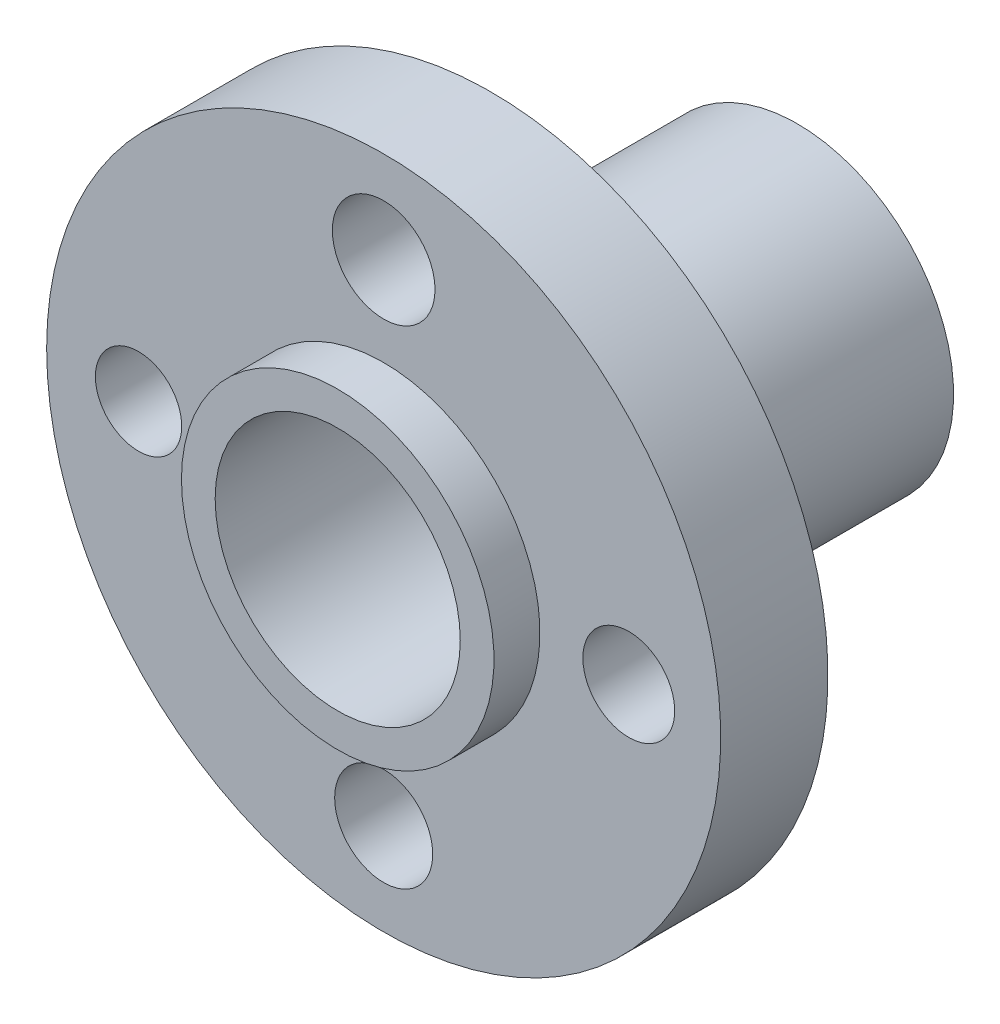
from build123d import *

# Parameters (mm, degrees)
SKETCH2_R          = 4
CUT_EXTRUDE1_DEPTH = 22.610182785
SKETCH3_R          = 1.409137036
SKETCH3_R_2        = 1.6
SKETCH3_R_3        = 1.49849824
SKETCH3_R_4        = 1.674312885
CUT_EXTRUDE2_DEPTH = 19.493242009


with BuildPart() as part:
    # Sketch1 → Revolve1 (revolve)
    with BuildSketch(Plane(origin=(0, 0, 0), x_dir=(1, 0, 0), z_dir=(0, 1, 0))):
        Polygon((0, 0), (5.1, 0), (5.1, 1.5), (11, 1.5), (11, 5), (5.1, 5), (5.1, 15), (0, 15), align=None)
    revolve(axis=Axis((0, 0, -15), (0, 0, 1)))

    # Sketch2 → Cut-Extrude1 (cut, through all)
    with BuildSketch(Plane(origin=(0, 0, -15), x_dir=(-1, 0, 0), z_dir=(0, 0, -1))):
        Circle(SKETCH2_R)
    extrude(amount=-CUT_EXTRUDE1_DEPTH, mode=Mode.SUBTRACT)

    # Sketch3 → Cut-Extrude2 (cut, through all)
    with BuildSketch(Plane(origin=(0, 0, -5), x_dir=(-1, 0, 0), z_dir=(0, 0, -1))):
        with Locations((8, 0)):
            Circle(SKETCH3_R)
        with Locations((0, -8)):
            Circle(SKETCH3_R_2)
        with Locations((-8, 0)):
            Circle(SKETCH3_R_3)
        with Locations((0, 8)):
            Circle(SKETCH3_R_4)
    extrude(amount=-CUT_EXTRUDE2_DEPTH, mode=Mode.SUBTRACT)


solid = part.part
